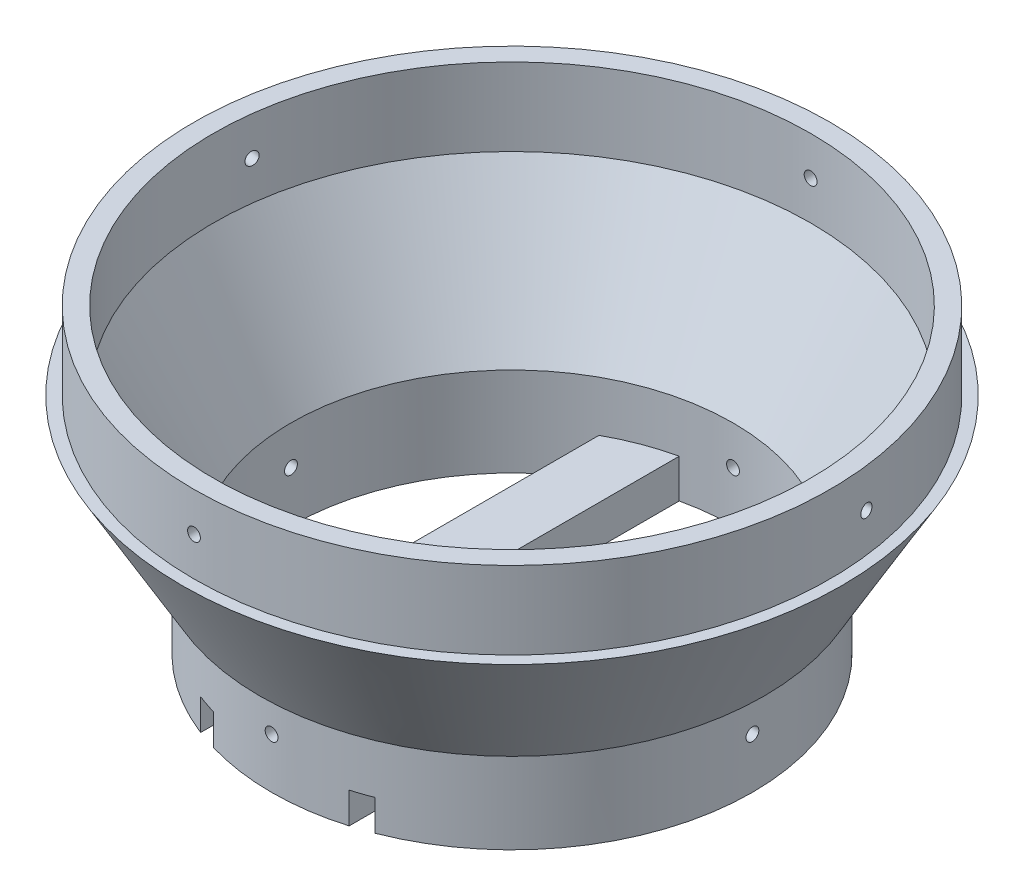
from build123d import *

# Parameters (mm, degrees)
BOSS_EXTRUDE1_REACH             = 134.044
SKETCH3_W                       = 15
SKETCH3_H                       = 10
BOSS_EXTRUDE1_DIRECTION_2_REACH = 134.044
CUT_EXTRUDE1_DEPTH              = 133.044085994
CUT_EXTRUDE1_DEPTH_BACK         = 133.044085994
SKETCH4_W                       = 5
SKETCH4_H                       = 8
M4_TAPPED_HOLE1_REACH           = 205.188
M4_TAPPED_HOLE1_BORE_R          = 1.65
M4_TAPPED_HOLE1_ON_FACE_2_REACH = 201.222
M4_TAPPED_HOLE1_BORE_2_R        = 1.65
M4_TAPPED_HOLE1_ON_FACE_3_REACH = 205.188
M4_TAPPED_HOLE1_BORE_3_R        = 1.65
M4_TAPPED_HOLE1_ON_FACE_4_REACH = 183.693
M4_TAPPED_HOLE1_BORE_4_R        = 1.65
M4_TAPPED_HOLE1_ON_FACE_5_REACH = 183.693
M4_TAPPED_HOLE1_BORE_5_R        = 1.65
M4_TAPPED_HOLE1_ON_FACE_6_REACH = 183.693
M4_TAPPED_HOLE1_BORE_6_R        = 1.65
M4_TAPPED_HOLE1_ON_FACE_7_REACH = 183.693
M4_TAPPED_HOLE1_BORE_7_R        = 1.65
M4_TAPPED_HOLE1_ON_FACE_8_REACH = 201.222
M4_TAPPED_HOLE1_BORE_8_R        = 1.65


with BuildPart() as part:
    # Sketch1 → Revolve1 (revolve)
    with BuildSketch(Plane.XY):
        Polygon((77, 54.641016151), (82, 54.641016151), (82, 34.641016151), (85, 34.641016151), (65, 0), (62, 0), (62, -23), (57, -23), (57, 0), (77, 34.641016151), align=None)
    revolve(axis=Axis((0, 0, 0), (0, 1, 0)))

    # Sketch3 → Boss-Extrude1 (add, up to next)
    with BuildSketch(Plane.XY, mode=Mode.PRIVATE) as boss_extrude1_sk1:
        with Locations((20, -18)):
            Rectangle(SKETCH3_W, SKETCH3_H)
    boss_extrude1_tool1 = extrude(boss_extrude1_sk1.sketch, amount=BOSS_EXTRUDE1_REACH, mode=Mode.PRIVATE) - part.part
    # Sketch3 → Boss-Extrude1 (add, up to next)
    with BuildSketch(Plane.XY, mode=Mode.PRIVATE) as boss_extrude1_sk2:
        with Locations((-20, -18)):
            Rectangle(SKETCH3_W, SKETCH3_H)
    boss_extrude1_tool2 = extrude(boss_extrude1_sk2.sketch, amount=BOSS_EXTRUDE1_REACH, mode=Mode.PRIVATE) - part.part
    add(boss_extrude1_tool1.solids().sort_by_distance((20, -18, 0))[0])
    add(boss_extrude1_tool2.solids().sort_by_distance((-20, -18, 0))[0])

    # Sketch3 → Boss-Extrude1 direction 2 (add, up to next)
    with BuildSketch(Plane.XY, mode=Mode.PRIVATE) as boss_extrude1_direction_2_sk1:
        with Locations((20, -18)):
            Rectangle(SKETCH3_W, SKETCH3_H)
    boss_extrude1_direction_2_tool1 = extrude(boss_extrude1_direction_2_sk1.sketch, amount=-BOSS_EXTRUDE1_DIRECTION_2_REACH, mode=Mode.PRIVATE) - part.part
    # Sketch3 → Boss-Extrude1 direction 2 (add, up to next)
    with BuildSketch(Plane.XY, mode=Mode.PRIVATE) as boss_extrude1_direction_2_sk2:
        with Locations((-20, -18)):
            Rectangle(SKETCH3_W, SKETCH3_H)
    boss_extrude1_direction_2_tool2 = extrude(boss_extrude1_direction_2_sk2.sketch, amount=-BOSS_EXTRUDE1_DIRECTION_2_REACH, mode=Mode.PRIVATE) - part.part
    add(boss_extrude1_direction_2_tool1.solids().sort_by_distance((20, -18, 0))[0])
    add(boss_extrude1_direction_2_tool2.solids().sort_by_distance((-20, -18, 0))[0])

    # Sketch4 → Cut-Extrude1 (cut, two sides: drawn at the far end of the back side and taken through both)
    with BuildSketch(Plane.XY.offset(-CUT_EXTRUDE1_DEPTH_BACK)):
        with Locations((-20, -19)):
            Rectangle(SKETCH4_W, SKETCH4_H)
        with Locations((20, -19)):
            Rectangle(SKETCH4_W, SKETCH4_H)
    extrude(amount=CUT_EXTRUDE1_DEPTH + CUT_EXTRUDE1_DEPTH_BACK, mode=Mode.SUBTRACT)

    # M4 Tapped Hole1 bore (on position points) → M4 Tapped Hole1 (cut, up to next)
    with BuildSketch(Plane(origin=(-81.387959798, 44.641016151, -10), x_dir=(0.121951219512, 0, -0.992536095092), z_dir=(-0.992536095092, 0, -0.121951219512)), mode=Mode.PRIVATE) as m4_tapped_hole1_sk1:
        Circle(M4_TAPPED_HOLE1_BORE_R)
    m4_tapped_hole1_tool1 = extrude(m4_tapped_hole1_sk1.sketch, amount=-M4_TAPPED_HOLE1_REACH, mode=Mode.PRIVATE) & part.part
    add(m4_tapped_hole1_tool1.solids().sort_by_distance((-81.38796, 44.641016, -10))[0], mode=Mode.SUBTRACT)

    # M4 Tapped Hole1 bore 2 (on position points) → M4 Tapped Hole1 on face 2 (cut, up to next)
    with BuildSketch(Plane(origin=(0, 44.641016151, -82), x_dir=(-1, 0, 0), z_dir=(0, 0, -1)), mode=Mode.PRIVATE) as m4_tapped_hole1_on_face_2_sk1:
        Circle(M4_TAPPED_HOLE1_BORE_2_R)
    m4_tapped_hole1_on_face_2_tool1 = extrude(m4_tapped_hole1_on_face_2_sk1.sketch, amount=-M4_TAPPED_HOLE1_ON_FACE_2_REACH, mode=Mode.PRIVATE) & part.part
    add(m4_tapped_hole1_on_face_2_tool1.solids().sort_by_distance((0, 44.641016, -82))[0], mode=Mode.SUBTRACT)

    # M4 Tapped Hole1 bore 3 (on position points) → M4 Tapped Hole1 on face 3 (cut, up to next)
    with BuildSketch(Plane(origin=(81.387959798, 44.641016151, -10), x_dir=(0.121951014775, 0, 0.992536120247), z_dir=(0.992536120247, 0, -0.121951014775)), mode=Mode.PRIVATE) as m4_tapped_hole1_on_face_3_sk1:
        Circle(M4_TAPPED_HOLE1_BORE_3_R)
    m4_tapped_hole1_on_face_3_tool1 = extrude(m4_tapped_hole1_on_face_3_sk1.sketch, amount=-M4_TAPPED_HOLE1_ON_FACE_3_REACH, mode=Mode.PRIVATE) & part.part
    add(m4_tapped_hole1_on_face_3_tool1.solids().sort_by_distance((81.38796, 44.641016, -10))[0], mode=Mode.SUBTRACT)

    # M4 Tapped Hole1 bore 4 (on position points) → M4 Tapped Hole1 on face 4 (cut, up to next)
    with BuildSketch(Plane(origin=(-62, -10, 0), x_dir=(0, 0, -1), z_dir=(-1, 0, 0)), mode=Mode.PRIVATE) as m4_tapped_hole1_on_face_4_sk1:
        Circle(M4_TAPPED_HOLE1_BORE_4_R)
    m4_tapped_hole1_on_face_4_tool1 = extrude(m4_tapped_hole1_on_face_4_sk1.sketch, amount=-M4_TAPPED_HOLE1_ON_FACE_4_REACH, mode=Mode.PRIVATE) & part.part
    add(m4_tapped_hole1_on_face_4_tool1.solids().sort_by_distance((-62, -10, 0))[0], mode=Mode.SUBTRACT)

    # M4 Tapped Hole1 bore 5 (on position points) → M4 Tapped Hole1 on face 5 (cut, up to next)
    with BuildSketch(Plane(origin=(0, -10, 62), x_dir=(1, 0, 0), z_dir=(0, 0, 1)), mode=Mode.PRIVATE) as m4_tapped_hole1_on_face_5_sk1:
        Circle(M4_TAPPED_HOLE1_BORE_5_R)
    m4_tapped_hole1_on_face_5_tool1 = extrude(m4_tapped_hole1_on_face_5_sk1.sketch, amount=-M4_TAPPED_HOLE1_ON_FACE_5_REACH, mode=Mode.PRIVATE) & part.part
    add(m4_tapped_hole1_on_face_5_tool1.solids().sort_by_distance((0, -10, 62))[0], mode=Mode.SUBTRACT)

    # M4 Tapped Hole1 bore 6 (on position points) → M4 Tapped Hole1 on face 6 (cut, up to next)
    with BuildSketch(Plane(origin=(62, -10, 0), x_dir=(0, 0, 1), z_dir=(1, 0, 0)), mode=Mode.PRIVATE) as m4_tapped_hole1_on_face_6_sk1:
        Circle(M4_TAPPED_HOLE1_BORE_6_R)
    m4_tapped_hole1_on_face_6_tool1 = extrude(m4_tapped_hole1_on_face_6_sk1.sketch, amount=-M4_TAPPED_HOLE1_ON_FACE_6_REACH, mode=Mode.PRIVATE) & part.part
    add(m4_tapped_hole1_on_face_6_tool1.solids().sort_by_distance((62, -10, 0))[0], mode=Mode.SUBTRACT)

    # M4 Tapped Hole1 bore 7 (on position points) → M4 Tapped Hole1 on face 7 (cut, up to next)
    with BuildSketch(Plane(origin=(0, -10, -62), x_dir=(-1, 0, 0), z_dir=(0, 0, -1)), mode=Mode.PRIVATE) as m4_tapped_hole1_on_face_7_sk1:
        Circle(M4_TAPPED_HOLE1_BORE_7_R)
    m4_tapped_hole1_on_face_7_tool1 = extrude(m4_tapped_hole1_on_face_7_sk1.sketch, amount=-M4_TAPPED_HOLE1_ON_FACE_7_REACH, mode=Mode.PRIVATE) & part.part
    add(m4_tapped_hole1_on_face_7_tool1.solids().sort_by_distance((0, -10, -62))[0], mode=Mode.SUBTRACT)

    # M4 Tapped Hole1 bore 8 (on position points) → M4 Tapped Hole1 on face 8 (cut, up to next)
    with BuildSketch(Plane(origin=(0, 44.641016151, 82), x_dir=(1, 0, 0), z_dir=(0, 0, 1)), mode=Mode.PRIVATE) as m4_tapped_hole1_on_face_8_sk1:
        Circle(M4_TAPPED_HOLE1_BORE_8_R)
    m4_tapped_hole1_on_face_8_tool1 = extrude(m4_tapped_hole1_on_face_8_sk1.sketch, amount=-M4_TAPPED_HOLE1_ON_FACE_8_REACH, mode=Mode.PRIVATE) & part.part
    add(m4_tapped_hole1_on_face_8_tool1.solids().sort_by_distance((0, 44.641016, 82))[0], mode=Mode.SUBTRACT)


solid = part.part
